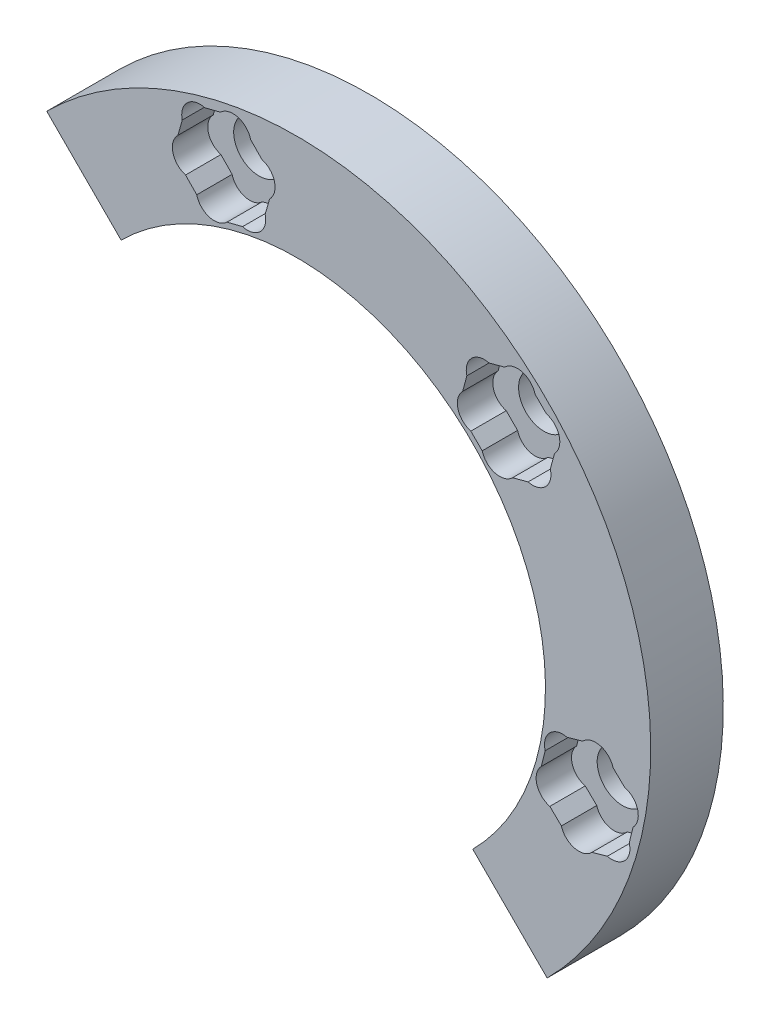
from build123d import *

# Parameters (mm, degrees)
SKETCH1_R      = 1.4
SHAPE_DEPTH    = 4
SKETCH2_R      = 1
NUT_CUTS_DEPTH = 1.95


with BuildPart() as part:
    # Sketch1 → Shape (new body)
    with BuildSketch(Plane.XY):
        with BuildLine():
            Line((74.690243902, 55.315518955), (78.792682927, 51.21551968))
            ThreePointArc((78.792682927, 51.21551968), (78.788582233, 78.788582233), (51.21551968, 78.792682927))
            Line((51.21551968, 78.792682927), (55.315518955, 74.690243902))
            ThreePointArc((55.315518955, 74.690243902), (70.244645349, 77.656369746), (78.7, 65))
            ThreePointArc((78.7, 65), (77.657929164, 59.759119419), (74.690243902, 55.315518955))
        make_face()
        with Locations((80.99969548, 60.967662643)):
            Circle(SKETCH1_R, mode=Mode.SUBTRACT)
        with Locations((60.967662643, 80.99969548)):
            Circle(SKETCH1_R, mode=Mode.SUBTRACT)
        with Locations((76.66726189, 76.66726189)):
            Circle(SKETCH1_R, mode=Mode.SUBTRACT)
    extrude(amount=SHAPE_DEPTH)

    # Sketch2 → Nut cuts (cut)
    with BuildSketch(Plane.XY.offset(4)):
        with Locations((79.184719423, 60.452208905)):
            Circle(SKETCH2_R)
        with Locations((59.138120402, 80.538603484)):
            Circle(SKETCH2_R)
        with Locations((59.65357414, 82.35357954)):
            Circle(SKETCH2_R)
        with Locations((61.483116382, 82.814671536)):
            Circle(SKETCH2_R)
        with Locations((62.797204884, 81.460787476)):
            Circle(SKETCH2_R)
        with Locations((62.281751146, 79.645811419)):
            Circle(SKETCH2_R)
        with Locations((60.452208905, 79.184719423)):
            Circle(SKETCH2_R)
        with Locations((78.001396561, 75.333127218)):
            Circle(SKETCH2_R)
        with Locations((80.538603484, 59.138120402)):
            Circle(SKETCH2_R)
        with Locations((76.178934708, 74.844800037)):
            Circle(SKETCH2_R)
        with Locations((74.844800037, 76.178934708)):
            Circle(SKETCH2_R)
        with Locations((75.333127218, 78.001396561)):
            Circle(SKETCH2_R)
        with Locations((77.155589071, 78.489723742)):
            Circle(SKETCH2_R)
        with Locations((78.489723742, 77.155589071)):
            Circle(SKETCH2_R)
        with Locations((79.645811419, 62.281751146)):
            Circle(SKETCH2_R)
        with Locations((81.460787476, 62.797204884)):
            Circle(SKETCH2_R)
        with Locations((82.814671536, 61.483116382)):
            Circle(SKETCH2_R)
        with Locations((82.35357954, 59.65357414)):
            Circle(SKETCH2_R)
        Polygon((63.766883398, 81.705171558), (61.756312815, 83.776629804), (58.95709206, 83.071153725), (58.168441888, 80.294219401), (60.179012471, 78.222761156), (62.978233226, 78.928237234), align=None)
        Polygon((78.928237234, 62.978233226), (78.222761156, 60.179012471), (80.294219401, 58.168441888), (83.071153725, 58.95709206), (83.776629804, 61.756312815), (81.705171558, 63.766883398), align=None)
        Polygon((78.708503342, 74.626020437), (79.455649569, 77.414408116), (77.414408116, 79.455649569), (74.626020437, 78.708503342), (73.87887421, 75.920115663), (75.920115663, 73.87887421), align=None)
    extrude(amount=-NUT_CUTS_DEPTH, mode=Mode.SUBTRACT)


solid = part.part
